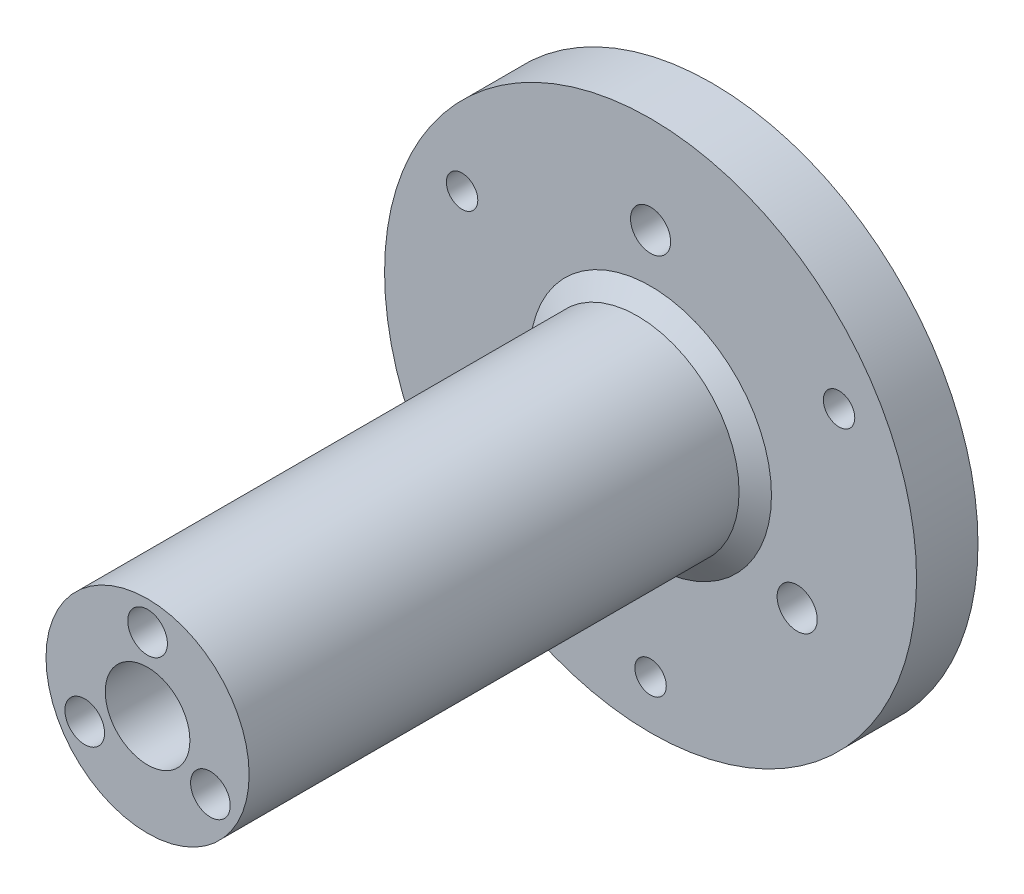
from build123d import *

# Parameters (mm, degrees)
ESQUISSE3_R         = 27.5
ESQUISSE3_R_2       = 1.625
ESQUISSE3_R_3       = 7.6
BOSS_EXTRU_1_DEPTH  = 6.35
ESQUISSE4_R         = 10.5
ESQUISSE4_R_2       = 7.6
BOSS_EXTRU_2_DEPTH  = 45
SKETCH1_R           = 10.5
SKETCH1_R_2         = 4.375
BOSS_EXTRUDE1_DEPTH = 7
SKETCH2_R           = 2.05
CUT_EXTRUDE1_DEPTH  = 6
CHAMFER2_SIZE       = 5.712592027
CHAMFER2_SIZE_2     = 4
CHAMFER3_SIZE       = 2
CHAMFER3_SIZE2      = 1.349017034
SKETCH3_R           = 2.075
CUT_EXTRUDE2_DEPTH  = 8


with BuildPart() as part:
    # Esquisse3 → Boss.-Extru.1 (new body)
    with BuildSketch(Plane.XY):
        Circle(ESQUISSE3_R)
        with Locations((-19.485571585, 11.25)):
            Circle(ESQUISSE3_R_2, mode=Mode.SUBTRACT)
        with Locations((19.485571585, 11.25)):
            Circle(ESQUISSE3_R_2, mode=Mode.SUBTRACT)
        with Locations((0, -22.5)):
            Circle(ESQUISSE3_R_2, mode=Mode.SUBTRACT)
        Circle(ESQUISSE3_R_3, mode=Mode.SUBTRACT)
    extrude(amount=BOSS_EXTRU_1_DEPTH)

    # Esquisse4 → Boss.-Extru.2 (add)
    with BuildSketch(Plane.XY.offset(6.35)):
        with Locations(Location((0, 0, 0), (0, 0, 180))):
            Circle(ESQUISSE4_R)
        Circle(ESQUISSE4_R_2, mode=Mode.SUBTRACT)
    extrude(amount=BOSS_EXTRU_2_DEPTH)

    # Sketch1 → Boss-Extrude1 (add)
    with BuildSketch(Plane.XY.offset(51.35)):
        with Locations(Location((0, 0, 0), (0, 0, 180))):
            Circle(SKETCH1_R)
        Circle(SKETCH1_R_2, mode=Mode.SUBTRACT)
    extrude(amount=BOSS_EXTRUDE1_DEPTH)

    # Sketch2 → Cut-Extrude1 (cut)
    with BuildSketch(Plane.XY.offset(58.35)):
        with Locations((0, 7.5)):
            Circle(SKETCH2_R)
        with Locations((-6.495190528, -3.75)):
            Circle(SKETCH2_R)
        with Locations((6.495190528, -3.75)):
            Circle(SKETCH2_R)
    extrude(amount=-CUT_EXTRUDE1_DEPTH, mode=Mode.SUBTRACT)

    # Chamfer2
    # the kernel refuses this chamfer: 5.712592027, 4 mm, written as the material it adds along each edge
    with BuildSketch(Plane(origin=(0, 0, 51.35), x_dir=(1, 0, 0), z_dir=(0, -1, 0))) as chamfer2_piece_1_section:
        Polygon((7.6, -CHAMFER2_SIZE), (7.6 - CHAMFER2_SIZE_2, 0), (7.6, 0), align=None)
    chamfer2_piece_1 = revolve(axis=Axis((0, 0, 51.35), (0, 0, 1)), mode=Mode.PRIVATE)
    chamfer2_piece_1 = chamfer2_piece_1 - Plane(origin=(0, 0, 47.891956694), x_dir=(1, 0, 0), z_dir=(0, 0, -1)) * Cylinder(4.375, 31, mode=Mode.PRIVATE)
    add(chamfer2_piece_1)

    # Chamfer3
    chamfer3_edges = [part.edges().sort_by_distance(p)[0] for p in [
        (10.5, 0, 6.35),
    ]]
    chamfer3_side = [part.faces().sort_by_distance(p)[0] for p in [
        (-26.722182541, 0, 6.35),
    ]]
    chamfer(chamfer3_edges, length=CHAMFER3_SIZE, length2=CHAMFER3_SIZE2, reference=chamfer3_side[0])

    # Sketch3 → Cut-Extrude2 (cut)
    with BuildSketch(Plane.XY.offset(6.35)):
        with Locations((0, 17.5)):
            Circle(SKETCH3_R)
        with Locations((-15.155444566, -8.75)):
            Circle(SKETCH3_R)
        with Locations((15.155444566, -8.75)):
            Circle(SKETCH3_R)
    extrude(amount=-CUT_EXTRUDE2_DEPTH, mode=Mode.SUBTRACT)


solid = part.part
